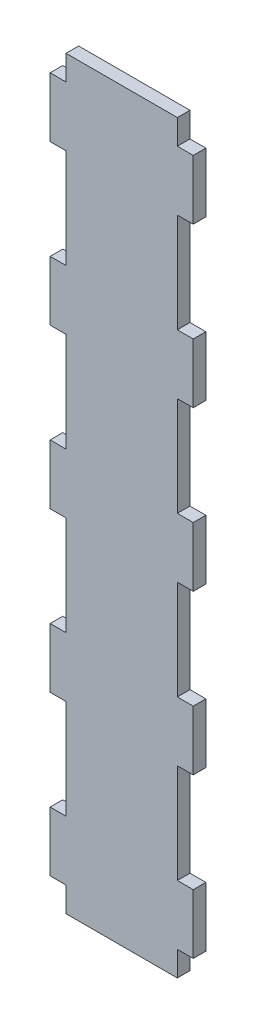
from build123d import *

# Parameters (mm, degrees)
SKETCH1_W          = 36
SKETCH1_H          = 200
BASE_FLANGE1_DEPTH = 3.175
SKETCH2_W          = 4
SKETCH2_H          = 25
CUT_EXTRUDE1_DEPTH = 10
LPATTERN1_COUNT    = 6
LPATTERN1_PITCH    = 40
SKETCH3_W          = 28
SKETCH3_H          = 6.25
CUT_EXTRUDE2_DEPTH = 10


# Sheet-metal steps are written as plain solids
with BuildPart() as part:
    # Sketch1 → Base-Flange1 (new body)
    with BuildSketch(Plane.XY):
        with Locations((25.081146731, 10.708830738)):
            Rectangle(SKETCH1_W, SKETCH1_H)
    extrude(amount=-BASE_FLANGE1_DEPTH)

    # Sketch2 → Cut-Extrude1 (cut)
    with BuildSketch(Plane.XY):
        with Locations((9.081146731, -89.291169262)):
            Rectangle(SKETCH2_W, SKETCH2_H)
        with Locations((41.081146731, -89.291169262)):
            Rectangle(SKETCH2_W, SKETCH2_H)
    cut_extrude1 = extrude(amount=-CUT_EXTRUDE1_DEPTH, mode=Mode.SUBTRACT)

    # LPattern1: Cut-Extrude1 ×6
    with Locations(*[(0, i * LPATTERN1_PITCH, 0) for i in range(1, LPATTERN1_COUNT)]):
        add(cut_extrude1, mode=Mode.SUBTRACT)

    # Sketch3 → Cut-Extrude2 (cut)
    with BuildSketch(Plane.XY):
        with Locations((25.081146731, 107.583830738)):
            Rectangle(SKETCH3_W, SKETCH3_H)
        with Locations((25.081146731, -86.166169262)):
            Rectangle(SKETCH3_W, SKETCH3_H)
    extrude(amount=-CUT_EXTRUDE2_DEPTH, mode=Mode.SUBTRACT)


solid = part.part
